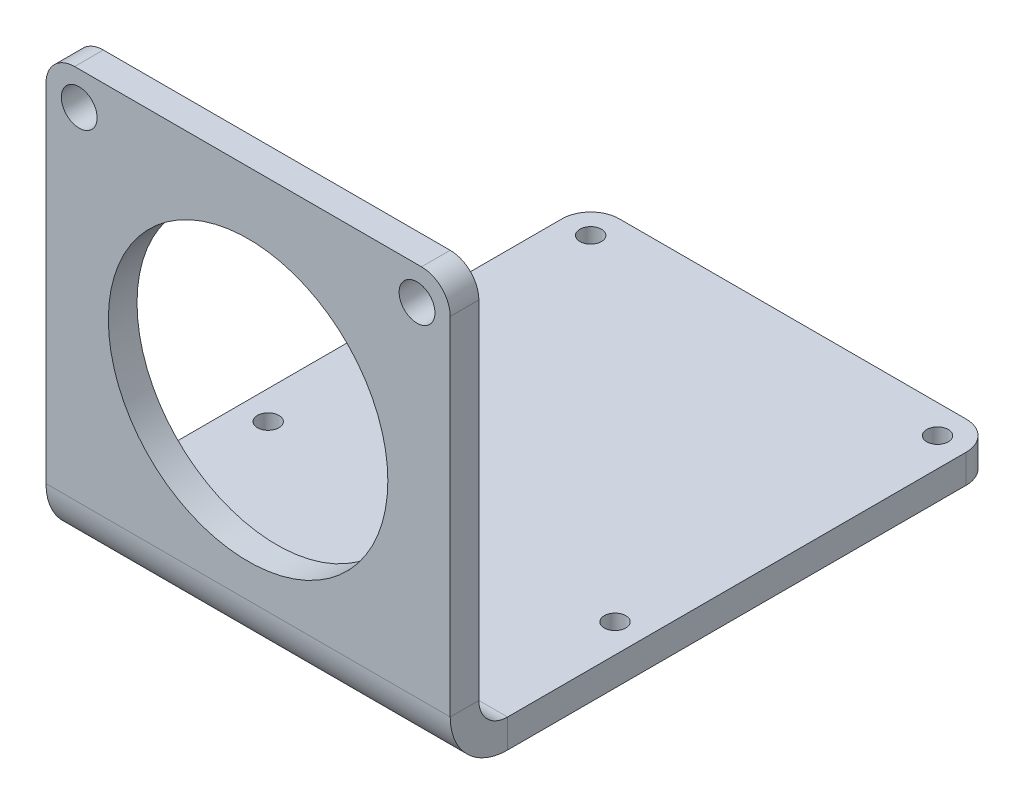
from build123d import *

# Parameters (mm, degrees)
BOSS_EXTRUDE1_DEPTH    = 4
SKETCH3_W              = 76
SKETCH3_H              = 4
BOSS_EXTRUDE2_DEPTH    = 56.4
SKETCH15_R             = 2.5
SKETCH15_R_2           = 19.5
CUT_EXTRUDE3_DEPTH     = 88.224308538
FILLET4_R              = 4
SKETCH18_R             = 1.5
CUT_EXTRUDE4_DEPTH     = 96.708933752
CONVERT_SOLID2_START   = -28.2
CONVERT_SOLID2_DEPTH   = 56.4
CONVERT_SOLID2_2_DEPTH = 56.4


# Read off the part's stored shape, not the designer's step: Convert-Solid2
with BuildPart() as part:
    # Sketch1 → Boss-Extrude1 (new body)
    with BuildSketch(Plane.XY):
        with BuildLine():
            Line((28.2, -28.2), (-28.2, -28.2))
            Line((-28.2, -28.2), (-28.2, 24.2))
            ThreePointArc((-28.2, 24.2), (-27.028427125, 27.028427125), (-24.2, 28.2))
            Line((-24.2, 28.2), (24.2, 28.2))
            ThreePointArc((24.2, 28.2), (27.028427125, 27.028427125), (28.2, 24.2))
            Line((28.2, 24.2), (28.2, -28.2))
        make_face()
    extrude(amount=BOSS_EXTRUDE1_DEPTH)

    # Sketch3 → Boss-Extrude2 (add)
    with BuildSketch(Plane(origin=(28.2, 0, 0), x_dir=(0, 0, -1), z_dir=(1, 0, 0))):
        with Locations((34, -30.2)):
            Rectangle(SKETCH3_W, SKETCH3_H)
    extrude(amount=-BOSS_EXTRUDE2_DEPTH)

    # Sketch15 → Cut-Extrude3 (cut, through all)
    with BuildSketch(Plane.XY.offset(4)):
        with Locations((-23.57, 23.57)):
            Circle(SKETCH15_R)
        with Locations((23.57, 23.57)):
            Circle(SKETCH15_R)
        Circle(SKETCH15_R_2)
    extrude(amount=-CUT_EXTRUDE3_DEPTH, mode=Mode.SUBTRACT)

    # Fillet4
    fillet4_edges = [part.edges().sort_by_distance(p)[0] for p in [
        (-28.2, -30.2, -72),
        (28.2, -30.2, -72),
    ]]
    fillet(fillet4_edges, radius=FILLET4_R)

    # Sketch18 → Cut-Extrude4 (cut, through all)
    with BuildSketch(Plane(origin=(0, -28.2, 0), x_dir=(1, 0, 0), z_dir=(0, 1, 0))):
        with Locations(Location((-24.2, 68, 0), (0, 0, 270))):
            Circle(SKETCH18_R)
        with Locations(Location((24.2, 68, 0), (0, 0, 270))):
            Circle(SKETCH18_R)
        with Locations(Location((-24.2, 23, 0), (0, 0, 270))):
            Circle(SKETCH18_R)
        with Locations(Location((24.2, 23, 0), (0, 0, 270))):
            Circle(SKETCH18_R)
    extrude(amount=-CUT_EXTRUDE4_DEPTH, mode=Mode.SUBTRACT)

    # Convert-Solid2 outline → Convert-Solid2 (cut)
    with BuildSketch(Plane.YZ.offset(CONVERT_SOLID2_START)):
        with BuildLine():
            ThreePointArc((-32.2, -4), (-29.856854249, 1.656854249), (-24.2, 4))
            Line((-24.2, 4), (-32.2, 4))
            Line((-32.2, 4), (-32.2, -4))
        make_face()
    extrude(amount=CONVERT_SOLID2_DEPTH, mode=Mode.SUBTRACT)

    # Convert-Solid2 2 outline → Convert-Solid2 2 (add)
    with BuildSketch(Plane.YZ.offset(CONVERT_SOLID2_START)):
        with BuildLine():
            ThreePointArc((-28.2, -4), (-27.028427125, -1.171572875), (-24.2, 0))
            Line((-24.2, 0), (-28.2, 0))
            Line((-28.2, 0), (-28.2, -4))
        make_face()
    extrude(amount=CONVERT_SOLID2_2_DEPTH)


solid = part.part
